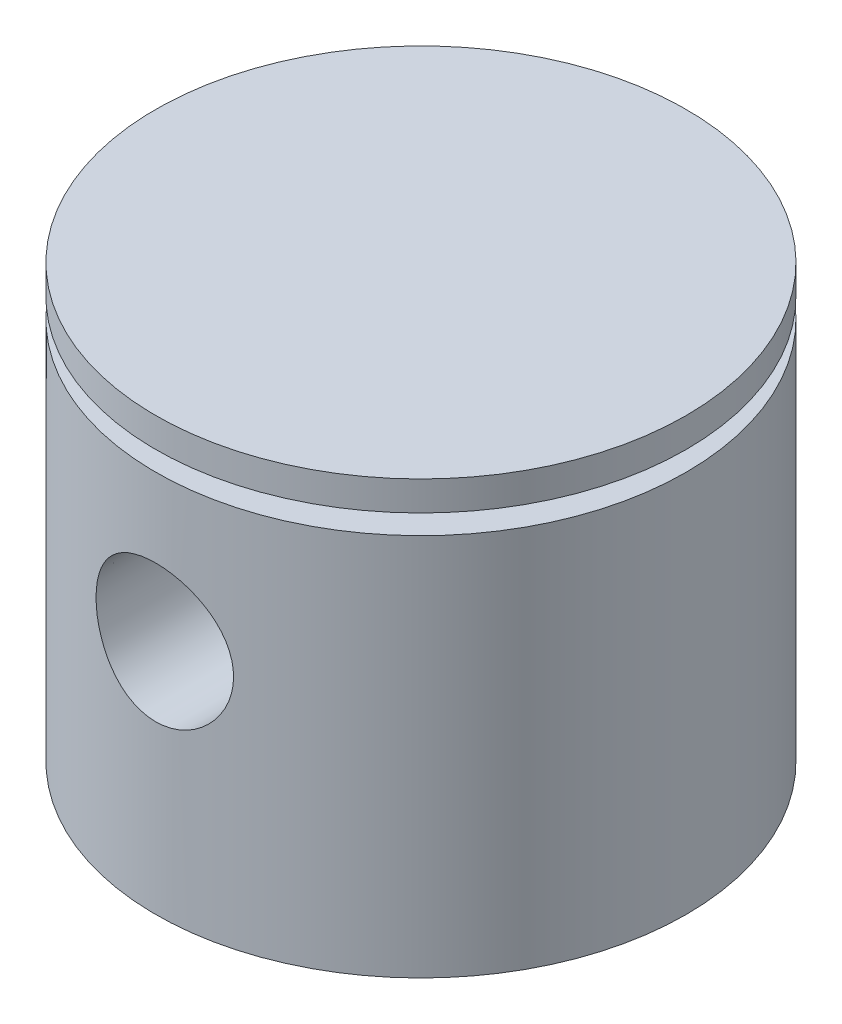
from build123d import *

# Parameters (mm, degrees)
ENL_V_START             = -135
ESQUISSE2_R             = 35
ENL_V_MAT_EXTRU_1_DEPTH = 270


with BuildPart() as part:
    # Esquisse1 → Révolution1 (revolve)
    with BuildSketch(Plane.XY, mode=Mode.PRIVATE) as r_volution1_sk:
        Polygon((0, 0), (5.822368421, 0), (5.822368421, 60), (55.822368421, 60), (55.822368421, 190), (125.822368421, 190), (125.822368421, 220), (-9.177631579, 220), (-9.177631579, 205), (10.822368421, 205), (10.822368421, 195), (-9.177631579, 195), (-9.177631579, 0), align=None)
    revolve(r_volution1_sk.sketch.rotate(Axis((125.822368421, 190, 0), (0, 1, 0)), 180), axis=Axis((125.822368421, 190, 0), (0, 1, 0)))

    # Esquisse2 → Enlèv. mat.-Extru.1 (cut)
    with BuildSketch(Plane.XY.offset(ENL_V_START)):
        with Locations((125.822368421, 120)):
            Circle(ESQUISSE2_R)
    extrude(amount=ENL_V_MAT_EXTRU_1_DEPTH, mode=Mode.SUBTRACT)


solid = part.part
